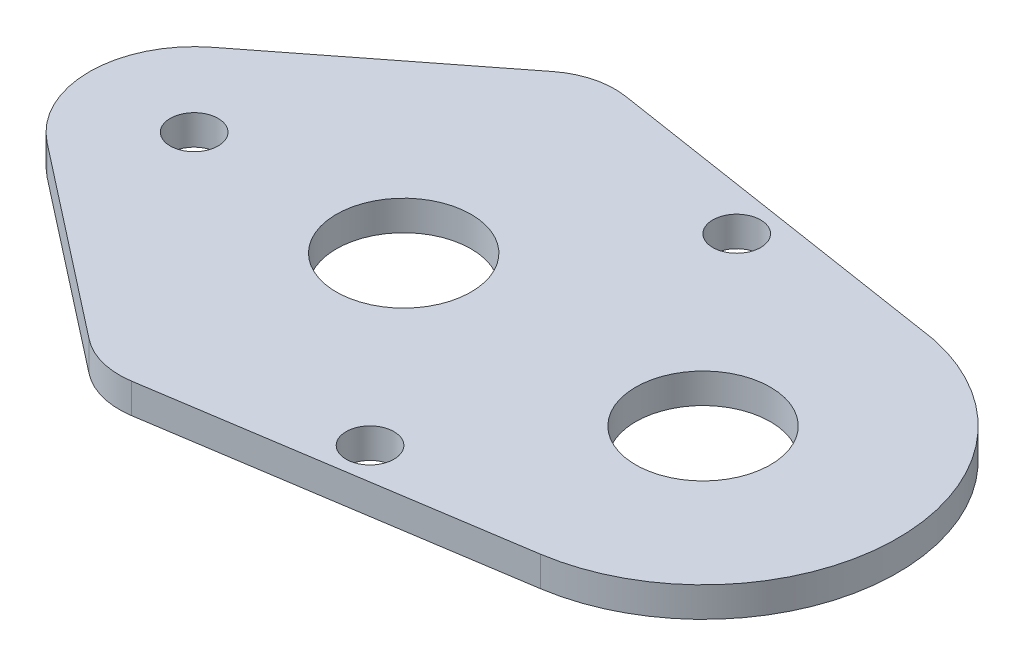
from build123d import *
from build123d.topology import SkipClean

# Parameters (mm, degrees)
SKETCH1_R               = 1.6
SKETCH1_R_2             = 1
SKETCH1_R_3             = 5.5
SKETCH1_R_4             = 4.5
BOSS_EXTRUDE2_DEPTH     = 2
BOSS_EXTRUDE3_START     = -2
SKETCH2_R               = 1
BOSS_EXTRUDE3_DEPTH     = 2
SKETCH3_R               = 1
CUT_EXTRUDE1_DEPTH      = 103
BOSS_EXTRUDE4_OUTLINE_R = 1
BOSS_EXTRUDE4_DEPTH     = 10
SKETCH5_R               = 87.063932705
CUT_EXTRUDE2_DEPTH      = 2
BOSS_EXTRUDE5_START     = 2
SKETCH6_R               = 1
SKETCH6_R_2             = 1.6
SKETCH6_R_3             = 4.5
BOSS_EXTRUDE5_DEPTH     = 2
SKETCH7_R               = 66.92041454
CUT_EXTRUDE3_DEPTH      = 10
SKETCH8_R               = 1.6
CUT_EXTRUDE4_DEPTH      = 10
BOSS_EXTRUDE6_DEPTH     = 2


# Read off the part's stored shape, not the designer's step: Boss-Extrude4
with BuildPart() as part:
    # Sketch1 → Boss-Extrude2 (new body)
    with BuildSketch(Plane(origin=(0, 0, 0), x_dir=(1, 0, 0), z_dir=(0, 1, 0))):
        with BuildLine():
            Line((12.313589515, -16.493996637), (35.979225245, -12.848450001))
            ThreePointArc((35.979225245, -12.848450001), (46.993067566, -0.424494085), (36.813648041, 12.691862933))
            Line((36.813648041, 12.691862933), (35.165189196, 12.947676785))
            Line((35.165189196, 12.947676785), (12.319067304, 16.493021261))
            ThreePointArc((12.319067304, 16.493021261), (11.720527595, 16.549330191), (11.119556233, 16.533395936))
            Line((11.119556233, 16.533395936), (-11.812019178, 14.541098507))
            ThreePointArc((-11.812019178, 14.541098507), (-13.247239988, 14.027709898), (-14.244912332, 12.87528787))
            Line((-14.244912332, 12.87528787), (-19.487592157, 2.204884721))
            ThreePointArc((-19.487592157, 2.204884721), (-19.693653105, -1.723258696), (-16.994761113, -4.584858569))
            Line((-16.994761113, -4.584858569), (9.557587922, -16.137143667))
            ThreePointArc((9.557587922, -16.137143667), (10.910298182, -16.51089082), (12.313589515, -16.493996637))
        make_face()
        with Locations(Location((11.552349036, -11.552285098, 0), (0, 0, 270))):
            Circle(SKETCH1_R, mode=Mode.SUBTRACT)
        with Locations(Location((25, -11, 0), (0, 0, 270))):
            Circle(SKETCH1_R_2, mode=Mode.SUBTRACT)
        with Locations(Location((-15, 0, 0), (0, 0, 270))):
            Circle(SKETCH1_R, mode=Mode.SUBTRACT)
        with Locations(Location((0, 0, 0), (0, 0, 270))):
            Circle(SKETCH1_R_3, mode=Mode.SUBTRACT)
        with Locations(Location((-11.552357038, 11.552357038, 0), (0, 0, 270))):
            Circle(SKETCH1_R, mode=Mode.SUBTRACT)
        with Locations(Location((11.552326466, 11.552160153, 0), (0, 0, 270))):
            Circle(SKETCH1_R, mode=Mode.SUBTRACT)
        with Locations(Location((14, 0, 0), (0, 0, 270))):
            Circle(SKETCH1_R_4, mode=Mode.SUBTRACT)
        with Locations(Location((34, 0, 0), (0, 0, 270))):
            Circle(SKETCH1_R_4, mode=Mode.SUBTRACT)
        with Locations(Location((25, 11, 0), (0, 0, 270))):
            Circle(SKETCH1_R_2, mode=Mode.SUBTRACT)
    extrude(amount=BOSS_EXTRUDE2_DEPTH)

    # Sketch2 → Boss-Extrude3 (add)
    with BuildSketch(Plane(origin=(0, 2, 0), x_dir=(1, 0, 0), z_dir=(0, 1, 0)).offset(BOSS_EXTRUDE3_START)):
        with Locations((25, 11)):
            Circle(SKETCH2_R)
        with Locations((25, -11)):
            Circle(SKETCH2_R)
    extrude(amount=BOSS_EXTRUDE3_DEPTH)

    # Sketch3 → Cut-Extrude1 (cut)
    with BuildSketch(Plane(origin=(0, 2, 0), x_dir=(1, 0, 0), z_dir=(0, 1, 0))):
        with Locations(Location((24, 13, 0), (0, 0, 270))):
            Circle(SKETCH3_R)
        with Locations(Location((24, -13, 0), (0, 0, 270))):
            Circle(SKETCH3_R)
    extrude(amount=-CUT_EXTRUDE1_DEPTH, mode=Mode.SUBTRACT)

    # Boss-Extrude4 outline → Boss-Extrude4 (add)
    with SkipClean():  # the faces are left unmerged after this step: merging them gives an invalid solid
        with BuildSketch(Plane(origin=(0, 2, 0), x_dir=(1, 0, 0), z_dir=(0, 1, 0))):
            with BuildLine():
                ThreePointArc((8.453372169, -15.47610242), (10.277484332, -16.387026041), (12.313589515, -16.493996637))
                Line((12.313589515, -16.493996637), (35.979225245, -12.848450001))
                ThreePointArc((35.979225245, -12.848450001), (46.993067566, -0.424494085), (36.813648041, 12.691862933))
                Line((36.813648041, 12.691862933), (12.319067304, 16.493021261))
                ThreePointArc((12.319067304, 16.493021261), (10.294223964, 16.391290043), (8.476229775, 15.493940099))
                Line((8.476229775, 15.493940099), (-4.306535369, 5.518491924))
                ThreePointArc((-4.306535369, 5.518491924), (-7, 0), (-4.306535369, -5.518491924))
                Line((-4.306535369, -5.518491924), (8.453372169, -15.47610242))
            make_face()
            with Locations((24, -13)):
                Circle(BOSS_EXTRUDE4_OUTLINE_R, mode=Mode.SUBTRACT)
            with BuildLine():
                Line((35.738243971, -12.126046672), (26.117255626, -13.608064851))
                Line((26.117255626, -13.608064851), (25.976685738, -12.695511096))
                ThreePointArc((25.976685738, -12.695511096), (23.695511096, -11.023314262), (22.023314262, -13.304488904))
                Line((22.023314262, -13.304488904), (22.16388415, -14.217042659))
                Line((22.16388415, -14.217042659), (12.27862862, -15.739768587))
                ThreePointArc((12.27862862, -15.739768587), (10.519552717, -15.67488522), (8.937649363, -14.902784407))
                Line((8.937649363, -14.902784407), (-3.845146577, -4.927204867))
                ThreePointArc((-3.845146577, -4.927204867), (-6.249813783, 0.048245957), (-3.768620923, 4.985979978))
                Line((-3.768620923, 4.985979978), (9.140409076, 14.743187339))
                ThreePointArc((9.140409076, 14.743187339), (10.553310252, 15.425397379), (12.119916334, 15.511685597))
                Line((12.119916334, 15.511685597), (22.133828609, 14.076211769))
                Line((22.133828609, 14.076211769), (22.020237278, 13.283794934))
                ThreePointArc((22.020237278, 13.283794934), (23.716205066, 11.020237278), (25.979762722, 12.716205066))
                Line((25.979762722, 12.716205066), (26.093354053, 13.508621901))
                Line((26.093354053, 13.508621901), (35.738243971, 12.126046672))
                ThreePointArc((35.738243971, 12.126046672), (46.25, 0), (35.738243971, -12.126046672))
            make_face(mode=Mode.SUBTRACT)
            with Locations((24, 13)):
                Circle(BOSS_EXTRUDE4_OUTLINE_R, mode=Mode.SUBTRACT)
        extrude(amount=BOSS_EXTRUDE4_DEPTH)
    add(part.part.scale(1), mode=Mode.REPLACE)  # the faces are merged on a copy

    # Sketch5 → Cut-Extrude2 (cut)
    with BuildSketch(Plane(origin=(0, 0, 0), x_dir=(-1, 0, 0), z_dir=(0, -1, 0))):
        Circle(SKETCH5_R)
    extrude(amount=-CUT_EXTRUDE2_DEPTH, mode=Mode.SUBTRACT)

    # Sketch6 → Boss-Extrude5 (add)
    with BuildSketch(Plane(origin=(0, 2, 0), x_dir=(-1, 0, 0), z_dir=(0, -1, 0)).offset(BOSS_EXTRUDE5_START)):
        with BuildLine():
            Line((4.306535369, -5.518491924), (-8.453372169, -15.47610242))
            ThreePointArc((-8.453372169, -15.47610242), (-10.277484331, -16.387026041), (-12.313589515, -16.493996637))
            Line((-12.313589515, -16.493996637), (-35.979225245, -12.848450001))
            ThreePointArc((-35.979225245, -12.848450001), (-46.993067566, -0.424494085), (-36.813648041, 12.691862933))
            Line((-36.813648041, 12.691862933), (-12.319067304, 16.493021261))
            ThreePointArc((-12.319067304, 16.493021261), (-10.294223964, 16.391290043), (-8.476229775, 15.493940099))
            Line((-8.476229775, 15.493940099), (4.306535369, 5.518491924))
            ThreePointArc((4.306535369, 5.518491924), (7, 0), (4.306535369, -5.518491924))
        make_face()
        with Locations(Location((-24, -13, 0), (0, 0, 270))):
            Circle(SKETCH6_R, mode=Mode.SUBTRACT)
        with Locations(Location((-24, 13, 0), (0, 0, 270))):
            Circle(SKETCH6_R, mode=Mode.SUBTRACT)
        with Locations(Location((0, 0, 0), (0, 0, 90))):
            Circle(SKETCH6_R_2, mode=Mode.SUBTRACT)
        with Locations(Location((-34, 0, 0), (0, 0, 90))):
            Circle(SKETCH6_R_3, mode=Mode.SUBTRACT)
        with Locations(Location((-14, 0, 0), (0, 0, 90))):
            Circle(SKETCH6_R_3, mode=Mode.SUBTRACT)
    extrude(amount=-BOSS_EXTRUDE5_DEPTH)

    # Sketch7 → Cut-Extrude3 (cut)
    with BuildSketch(Plane(origin=(0, 12, 0), x_dir=(1, 0, 0), z_dir=(0, 1, 0))):
        Circle(SKETCH7_R)
    extrude(amount=-CUT_EXTRUDE3_DEPTH, mode=Mode.SUBTRACT)

    # Sketch8 → Cut-Extrude4 (cut)
    with BuildSketch(Plane(origin=(0, 0, 0), x_dir=(-1, 0, 0), z_dir=(0, -1, 0))):
        with Locations((-24, -12.25)):
            Circle(SKETCH8_R)
        with Locations((-24, 12.25)):
            Circle(SKETCH8_R)
    extrude(amount=-CUT_EXTRUDE4_DEPTH, mode=Mode.SUBTRACT)

    # Sketch9 → Boss-Extrude6 (add)
    with BuildSketch(Plane(origin=(0, 0, 0), x_dir=(-1, 0, 0), z_dir=(0, -1, 0))):
        with BuildLine():
            ThreePointArc((-24.746843357, -13.665), (-24, -13.85), (-23.253156643, -13.665))
            ThreePointArc((-23.253156643, -13.665), (-24, -14), (-24.746843357, -13.665))
        make_face()
        with BuildLine():
            ThreePointArc((-23.253156643, 13.665), (-24, 13.85), (-24.746843357, 13.665))
            ThreePointArc((-24.746843357, 13.665), (-24, 14), (-23.253156643, 13.665))
        make_face()
    extrude(amount=-BOSS_EXTRUDE6_DEPTH)


solid = part.part
